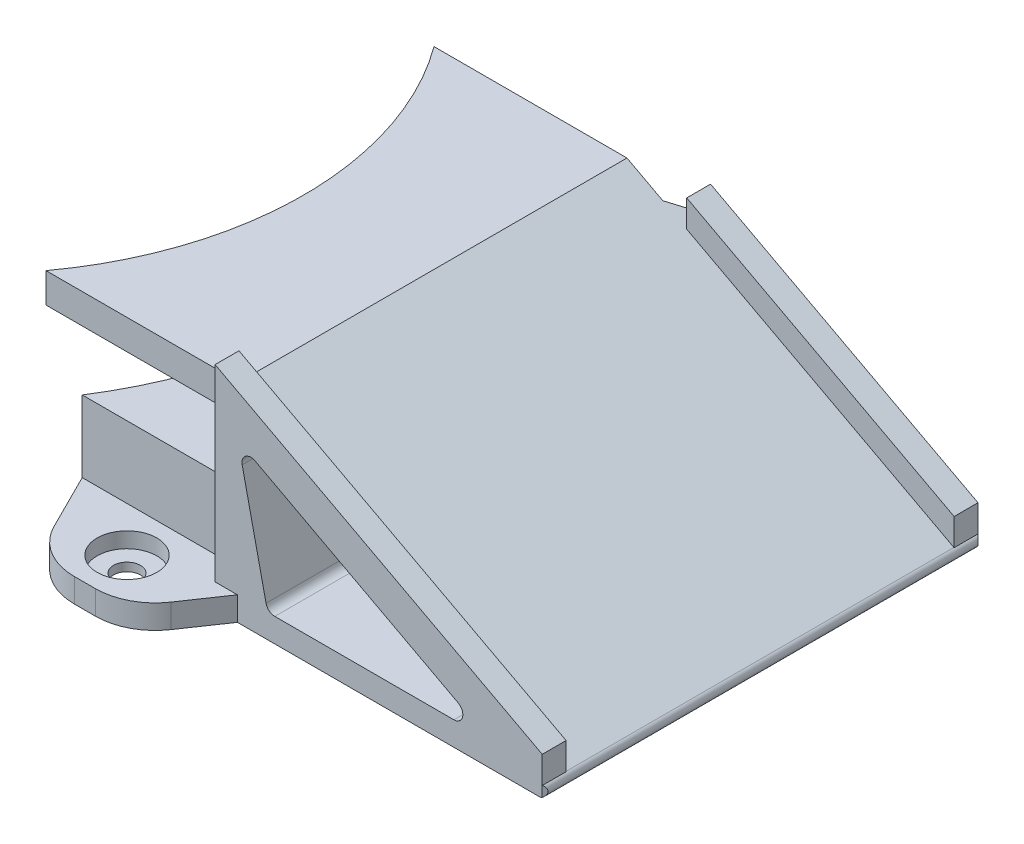
from build123d import *

# Parameters (mm, degrees)
ESTRUSIONE_ESTRUSIONE1_DEPTH                         = 90
TAGLIO_ESTRUSIONE1_DEPTH                             = 60
SCHIZZO3_R                                           = 60
TAGLIO_ESTRUSIONE2_DEPTH                             = 21
ESTRUSIONE_ESTRUSIONE2_DEPTH                         = 4
FORO_LAMATO_PER_VITE_M4_A_TESTA_CILINDRI_D           = 4.5
FORO_LAMATO_PER_VITE_M4_A_TESTA_CILINDRI_DEPTH       = 8
FORO_LAMATO_PER_VITE_M4_A_TESTA_CILINDRI_CBORE_D     = 10
FORO_LAMATO_PER_VITE_M4_A_TESTA_CILINDRI_CBORE_DEPTH = 2.6
FORO_LAMATO_PER_VITE_M4_A_TESTA_CILINDRI_TIP         = 1.351936393
RACCORDO3_R                                          = 10
ESTRUSIONE_ESTRUSIONE3_DEPTH                         = 4
ESTRUSIONE_ESTRUSIONE4_DEPTH                         = 4
TAGLIO_ESTRUSIONE3_DEPTH                             = 179
SMUSSO1_SIZE                                         = 4
RACCORDO4_START                                      = -5
RACCORDO4_DEPTH                                      = 75
RACCORDO4_2_DEPTH                                    = 65
SMUSSO2_SIZE                                         = 4
SMUSSO3_SIZE                                         = 4


with BuildPart() as part:
    # Schizzo1 → Estrusione-Estrusione1 (new body)
    with BuildSketch(Plane.XY):
        Polygon((-115, 26), (0, 26), (0, 16), (-45, 16), (-45, 0), (58.302520426, 0), (0, 31), (-115, 31), align=None)
    extrude(amount=ESTRUSIONE_ESTRUSIONE1_DEPTH)

    # Schizzo2 → Taglio-Estrusione1 (cut)
    with BuildSketch(Plane(origin=(0, 31, 0), x_dir=(1, 0, 0), z_dir=(0, 1, 0))):
        with BuildLine():
            Line((-32.326881201, -65), (58.302520426, -65))
            Line((58.302520426, -65), (58.302520426, -90))
            Line((58.302520426, -90), (-115, -90))
            Line((-115, -90), (-115, 0))
            Line((-115, 0), (-32.326881201, 0))
            ThreePointArc((-32.326881201, 0), (-21.697479574, -32.5), (-32.326881201, -65))
        make_face()
    extrude(amount=-TAGLIO_ESTRUSIONE1_DEPTH, mode=Mode.SUBTRACT)

    # Schizzo3 → Taglio-Estrusione2 (cut)
    with BuildSketch(Plane.XZ):
        with Locations((-76.697479574, 32.5)):
            Circle(SCHIZZO3_R)
    extrude(amount=-TAGLIO_ESTRUSIONE2_DEPTH, mode=Mode.SUBTRACT)

    # Schizzo4 → Estrusione-Estrusione2 (add)
    with BuildSketch(Plane.XZ):
        Polygon((-26.26187707, 65), (-18.76187707, 80), (-3.76187707, 80), (3.73812293, 69), (3.73812293, 65), align=None)
        Polygon((-26.26187707, 0), (-18.76187707, -15), (-3.76187707, -15), (3.73812293, -4), (3.73812293, 0), align=None)
    extrude(amount=-ESTRUSIONE_ESTRUSIONE2_DEPTH)

    # Foro lamato per Vite M4 a testa cilindrica piana-1
    with Locations(Plane(origin=(-11.26187707, 4, 72.5), x_dir=(0, 0, 1), z_dir=(0, 1, 0))):
        with Locations((0, 0), (-80, 0)):
            CounterBoreHole(FORO_LAMATO_PER_VITE_M4_A_TESTA_CILINDRI_D / 2, FORO_LAMATO_PER_VITE_M4_A_TESTA_CILINDRI_CBORE_D / 2, FORO_LAMATO_PER_VITE_M4_A_TESTA_CILINDRI_CBORE_DEPTH, depth=FORO_LAMATO_PER_VITE_M4_A_TESTA_CILINDRI_DEPTH)
            with Locations((0, 0, -(FORO_LAMATO_PER_VITE_M4_A_TESTA_CILINDRI_DEPTH + FORO_LAMATO_PER_VITE_M4_A_TESTA_CILINDRI_TIP / 2))):  # 118° drill point
                Cone(0, FORO_LAMATO_PER_VITE_M4_A_TESTA_CILINDRI_D / 2, FORO_LAMATO_PER_VITE_M4_A_TESTA_CILINDRI_TIP, mode=Mode.SUBTRACT)

    # Raccordo3
    raccordo3_edges = [part.edges().sort_by_distance(p)[0] for p in [
        (-18.76187707, 2, 80),
        (-3.76187707, 2, 80),
        (-3.76187707, 2, -15),
        (-18.76187707, 2, -15),
    ]]
    fillet(raccordo3_edges, radius=RACCORDO3_R)

    # Schizzo9 → Estrusione-Estrusione3 (add)
    with BuildSketch(Plane.XY.offset(65)):
        Polygon((3.73812293, 0), (3.73812293, 4), (0, 4), (0, 35.530280203), (54.802520426, 6.391263214), (54.802520426, 0), align=None)
    extrude(amount=ESTRUSIONE_ESTRUSIONE3_DEPTH)

    # Schizzo10 → Estrusione-Estrusione4 (add)
    with BuildSketch(Plane(origin=(0, 0, 0), x_dir=(-1, 0, 0), z_dir=(0, 0, -1))):
        Polygon((-54.802520426, 0), (-54.802520426, 6.391263214), (-10, 30.213185886), (-10, 4), (-3.73812293, 4), (-3.73812293, 0), align=None)
    extrude(amount=ESTRUSIONE_ESTRUSIONE4_DEPTH)

    # Schizzo6 → Taglio-Estrusione3 (cut)
    with BuildSketch(Plane.XY.offset(69)):
        with BuildLine():
            Line((6.704207344, 24.902542066), (40.704207344, 6.824421389))
            ThreePointArc((40.704207344, 6.824421389), (41.455443589, 5.137117157), (40, 4))
            Line((40, 4), (10, 4))
            ThreePointArc((10, 4), (9.06087354, 4.330366941), (8.535422195, 5.175944678))
            Line((8.535422195, 5.175944678), (4.535422195, 23.254065354))
            ThreePointArc((4.535422195, 23.254065354), (5.092305295, 24.772310914), (6.704207344, 24.902542066))
        make_face()
    extrude(amount=-TAGLIO_ESTRUSIONE3_DEPTH, mode=Mode.SUBTRACT)

    # Smusso1
    # the kernel refuses this chamfer: 4 mm, written as the material it adds along each edge
    with BuildSketch(Plane(origin=(0, 15.713268048, 65), x_dir=(-1, 0, 0), z_dir=(0, 1, 0))) as smusso1_piece_1_section:
        Polygon((SMUSSO1_SIZE, 0), (0, SMUSSO1_SIZE), (0, 0), align=None)
    smusso1_piece_1 = extrude(amount=25.573463904, mode=Mode.PRIVATE)
    smusso1_piece_1 = split(smusso1_piece_1, bisect_by=Plane(origin=(0, 16, 65), z_dir=(0, -1, 0)), keep=Keep.TOP, mode=Mode.PRIVATE)
    add(smusso1_piece_1)
    with BuildSketch(Plane(origin=(0, 26, 65), x_dir=(-1, 0, 0), z_dir=(0, 1, 0))) as smusso1_piece_2:
        Polygon((SMUSSO1_SIZE, 0), (0, SMUSSO1_SIZE), (0, 0), align=None)
    extrude(amount=5)
    with BuildSketch(Plane(origin=(0, 4, 65), x_dir=(0, 0, 1), z_dir=(0, 1, 0))) as smusso1_piece_3:
        Polygon((SMUSSO1_SIZE, 0), (0, -SMUSSO1_SIZE), (0, 0), align=None)
    extrude(amount=12)
    with BuildSketch(Plane(origin=(0, -6.286731952, 65), x_dir=(0, 0, 1), z_dir=(0, 1, 0))) as smusso1_piece_4_section:
        Polygon((SMUSSO1_SIZE, 0), (0, -SMUSSO1_SIZE), (0, 0), align=None)
    smusso1_piece_4 = extrude(amount=32.573463904, mode=Mode.PRIVATE)
    smusso1_piece_4 = split(smusso1_piece_4, bisect_by=Plane(origin=(0, 26, 65), z_dir=(0, 1, 0)), keep=Keep.TOP, mode=Mode.PRIVATE)
    add(smusso1_piece_4)
    # the kernel refuses this chamfer: 4 mm, written as the material it takes off along each edge
    with BuildSketch(Plane(origin=(0, 26, 0), x_dir=(1, 0, 0), z_dir=(0, -1, 0))) as smusso1_2_piece_1:
        Polygon((SMUSSO1_SIZE, 0), (0, SMUSSO1_SIZE), (0, 0), align=None)
    extrude(amount=10, mode=Mode.SUBTRACT)

    # Raccordo4: read off the stored shape, not the designer's step
    # Raccordo4 outline → Raccordo4 (cut)
    with BuildSketch(Plane.XY.offset(RACCORDO4_START)):
        with BuildLine():
            Line((54.291739492, 0), (58.302520426, 0))
            Line((58.302520426, 0), (54.802520426, 1.860983011))
            Line((54.802520426, 1.860983011), (54.802520426, 1.859710904))
            ThreePointArc((54.802520426, 1.859710904), (55.25602962, 0.735151839), (54.291739492, 0))
        make_face()
    extrude(amount=RACCORDO4_DEPTH, mode=Mode.SUBTRACT)

    # Raccordo4 2 outline → Raccordo4 2 (cut)
    with BuildSketch(Plane.XY):
        with BuildLine():
            ThreePointArc((54.761211055, 1.882947593), (54.782003426, 1.871574022), (54.802520426, 1.859710904))
            Line((54.802520426, 1.859710904), (54.802520426, 1.860983011))
            Line((54.802520426, 1.860983011), (54.761211055, 1.882947593))
        make_face()
    extrude(amount=RACCORDO4_2_DEPTH, mode=Mode.SUBTRACT)

    # Smusso2
    # the kernel refuses this chamfer: 4 mm, written as the material it adds along each edge
    with BuildSketch(Plane(origin=(54.802520426, 12.146442856, 65), x_dir=(0, 0, 1), z_dir=(0, -1, 0))) as smusso2_piece_1_section:
        Polygon((SMUSSO2_SIZE, 0), (0, -SMUSSO2_SIZE), (0, 0), align=None)
    smusso2_piece_1 = extrude(amount=22.292885711, mode=Mode.PRIVATE)
    smusso2_piece_1 = smusso2_piece_1 & Plane(origin=(54.291739491, 1, 65), x_dir=(0.5107809344553311, 0.8597109031511343, 0), z_dir=(0, 0, -1)) * Cylinder(1, 61, mode=Mode.PRIVATE)
    add(smusso2_piece_1)
    # the kernel refuses this chamfer: 4 mm, written as the material it adds along each edge
    with BuildSketch(Plane(origin=(54.802520426, -10.146442855, 0), x_dir=(0, 0, -1), z_dir=(0, 1, 0))) as smusso2_2_piece_1_section:
        Polygon((SMUSSO2_SIZE, 0), (0, -SMUSSO2_SIZE), (0, 0), align=None)
    smusso2_2_piece_1 = extrude(amount=22.292885711, mode=Mode.PRIVATE)
    smusso2_2_piece_1 = smusso2_2_piece_1 & Plane(origin=(54.291739491, 1, 0), x_dir=(0.5107809344553311, 0.8597109031511343, 0), z_dir=(0, 0, -1)) * Cylinder(1, 61, mode=Mode.PRIVATE)
    add(smusso2_2_piece_1)

    # Smusso3
    smusso3_edges = [part.edges().sort_by_distance(p)[0] for p in [
        (10, 24.416521855, 0),
    ]]
    chamfer(smusso3_edges, length=SMUSSO3_SIZE - 0.0001)  # a hair under: the kernel refuses the full size


solid = part.part
